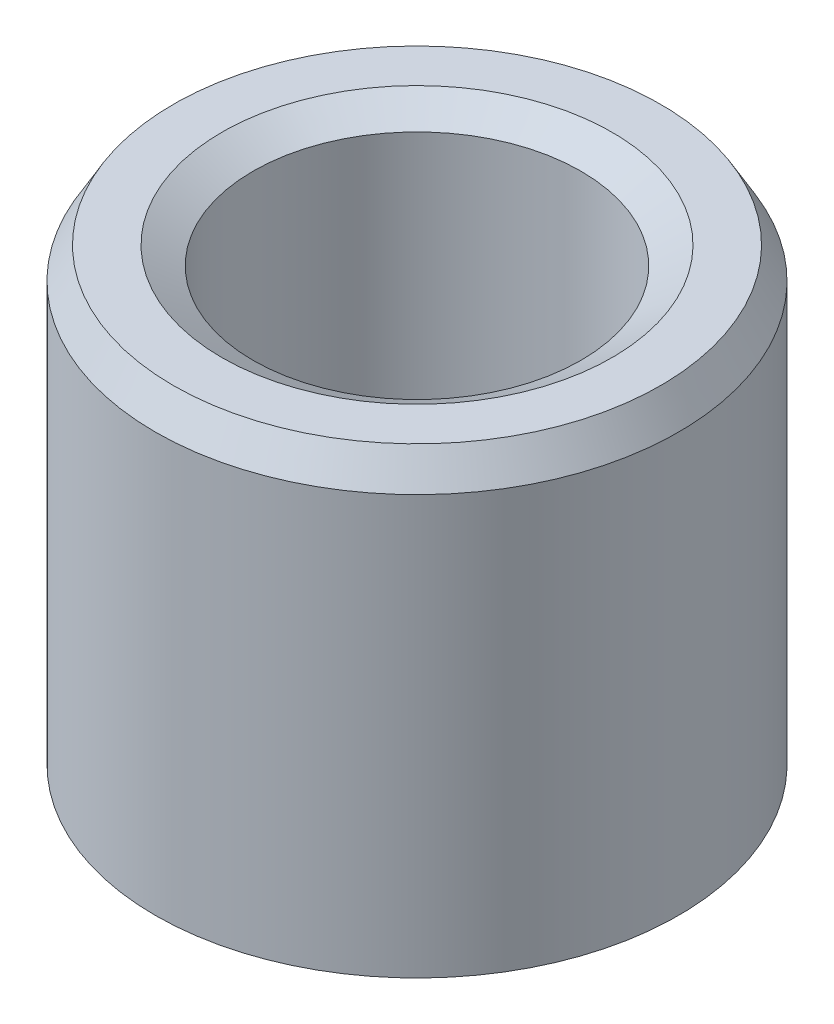
from build123d import *
from OCP.BRepFilletAPI import BRepFilletAPI_MakeChamfer

# Parameters (mm, degrees)
SKETCH1_R           = 7.5
BOSS_EXTRUDE1_DEPTH = 13.410640603
SKETCH2_R           = 4.698201836
CUT_EXTRUDE1_DEPTH  = 18.098107538
CHAMFER1_SIZE       = 0.895604281
CHAMFER1_SIZE2      = 0.517077373


with BuildPart() as part:
    # Sketch1 → Boss-Extrude1 (new body)
    with BuildSketch(Plane(origin=(0, 0, 0), x_dir=(1, 0, 0), z_dir=(0, 1, 0))):
        Circle(SKETCH1_R)
    extrude(amount=BOSS_EXTRUDE1_DEPTH)

    # Sketch2 → Cut-Extrude1 (cut, through all)
    with BuildSketch(Plane(origin=(0, 0, 0), x_dir=(1, 0, 0), z_dir=(0, 1, 0))):
        Circle(SKETCH2_R)
    extrude(amount=CUT_EXTRUDE1_DEPTH, mode=Mode.SUBTRACT)

    # Chamfer1: one chamfer whose edges measure the first distance from different faces: ONE call of the kernel's chamfer builder (chamfer() names one face for all edges)
    chamfer1_edges_1 = [part.edges().sort_by_distance(p)[0] for p in [
        (-4.698201836, 13.410640603, 0),
    ]]
    chamfer1_side_1 = [part.faces().sort_by_distance(p)[0] for p in [
        (-7.287867966, 13.410640603, 0),
    ]]
    chamfer1_edges_2 = [part.edges().sort_by_distance(p)[0] for p in [
        (-4.698201836, 0, 0),
    ]]
    chamfer1_side_2 = [part.faces().sort_by_distance(p)[0] for p in [
        (-4.698201836, 6.705320302, 0),
    ]]
    chamfer1_edges_3 = [part.edges().sort_by_distance(p)[0] for p in [
        (-7.5, 0, 0),
    ]]
    chamfer1_side_3 = [part.faces().sort_by_distance(p)[0] for p in [
        (-7.287867966, 0, 0),
    ]]
    chamfer1_edges_4 = [part.edges().sort_by_distance(p)[0] for p in [
        (-7.5, 13.410640603, 0),
    ]]
    chamfer1_side_4 = [part.faces().sort_by_distance(p)[0] for p in [
        (-7.5, 6.705320302, 0),
    ]]
    chamfer1 = BRepFilletAPI_MakeChamfer(part.part.solid().wrapped)
    for e in chamfer1_edges_1:
        chamfer1.Add(CHAMFER1_SIZE, CHAMFER1_SIZE2, e.wrapped, chamfer1_side_1[0].wrapped)  # the first distance lies on this face
    for e in chamfer1_edges_2:
        chamfer1.Add(CHAMFER1_SIZE, CHAMFER1_SIZE2, e.wrapped, chamfer1_side_2[0].wrapped)  # the first distance lies on this face
    for e in chamfer1_edges_3:
        chamfer1.Add(CHAMFER1_SIZE, CHAMFER1_SIZE2, e.wrapped, chamfer1_side_3[0].wrapped)  # the first distance lies on this face
    for e in chamfer1_edges_4:
        chamfer1.Add(CHAMFER1_SIZE, CHAMFER1_SIZE2, e.wrapped, chamfer1_side_4[0].wrapped)  # the first distance lies on this face
    add(Compound.cast(chamfer1.Shape()), mode=Mode.REPLACE)


solid = part.part
